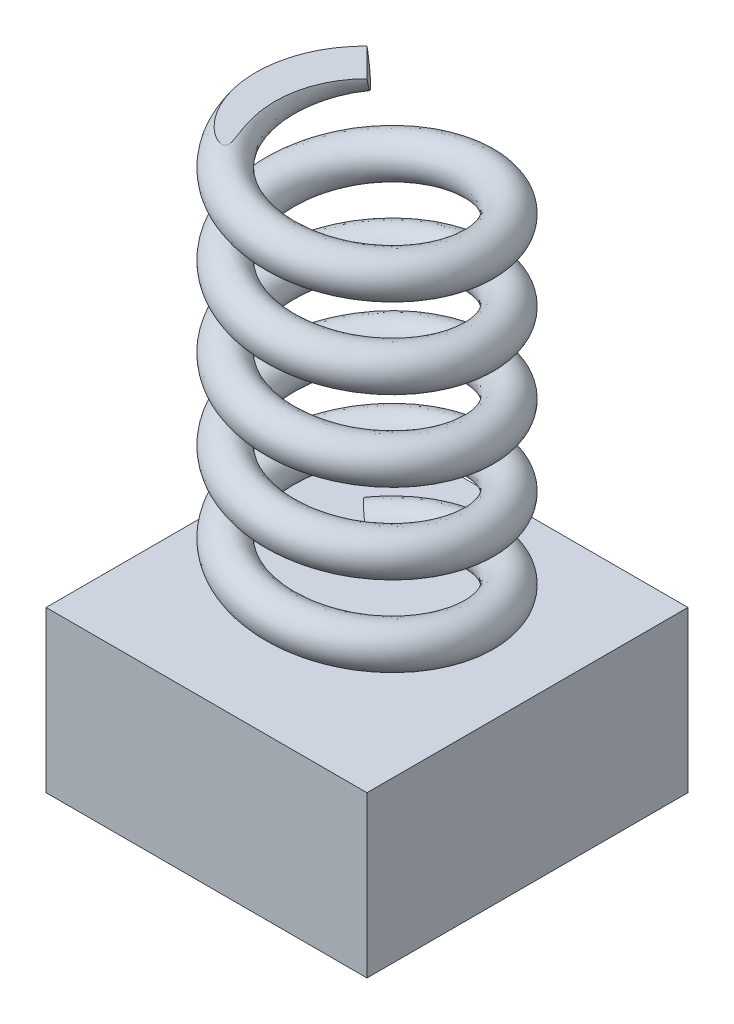
from build123d import *

# Parameters (mm, degrees)
SKETCH_1_W              = 16
SKETCH_1_H              = 16
EXTRUDE_1_DEPTH         = 8
SWEEP_1_PITCH           = 4
SWEEP_1_HEIGHT          = 20
SWEEP_1_RADIUS          = 5
SWEEP_1_START_ANGLE     = -135
SWEEP_1_PROFILE_R       = 1
CUT_EXTRUDE_START       = 28
CUT_EXTRUDE_1_OUTLINE_W = 6
CUT_EXTRUDE_1_OUTLINE_H = 11
CUT_EXTRUDE_1_DEPTH     = 0.991991546


with BuildPart() as part:
    # 草图1 → 凸台-拉伸1 (new body)
    with BuildSketch(Plane(origin=(0, 0, 0), x_dir=(1, 0, 0), z_dir=(0, 1, 0))):
        Rectangle(SKETCH_1_W, SKETCH_1_H)
    extrude(amount=EXTRUDE_1_DEPTH)

    # 扫描1: sweep along a helix
    with BuildLine() as sweep_1_path:
        add(Helix(SWEEP_1_PITCH, SWEEP_1_HEIGHT, SWEEP_1_RADIUS, center=(0, 8, 0), direction=(0, 1, 0), lefthand=True, mode=Mode.PRIVATE).rotate(Axis((0, 8, 0), (0, 1, 0)), SWEEP_1_START_ANGLE))
    # 扫描1 profile (on start of the path) → 扫描1 (sweep)
    with BuildSketch(Plane(origin=(-3.535533906, 8, -3.535533906), x_dir=(0.7071067811864822, 0, 0.7071067811866131), z_dir=(0.7014439490182723, 0.12630428643353764, -0.7014439490181424))):
        Circle(SWEEP_1_PROFILE_R)
    sweep(path=sweep_1_path.line, is_frenet=True)

    # 切除-拉伸1: read off the stored shape, not the designer's step
    # 切除-拉伸1 outline → 切除-拉伸1 (cut)
    with BuildSketch(Plane(origin=(0, 0, 0), x_dir=(1, 0, 0), z_dir=(0, 1, 0)).offset(CUT_EXTRUDE_START)):
        with Locations((-4, 0.5)):
            Rectangle(CUT_EXTRUDE_1_OUTLINE_W, CUT_EXTRUDE_1_OUTLINE_H)
    extrude(amount=CUT_EXTRUDE_1_DEPTH, mode=Mode.SUBTRACT)


solid = part.part
